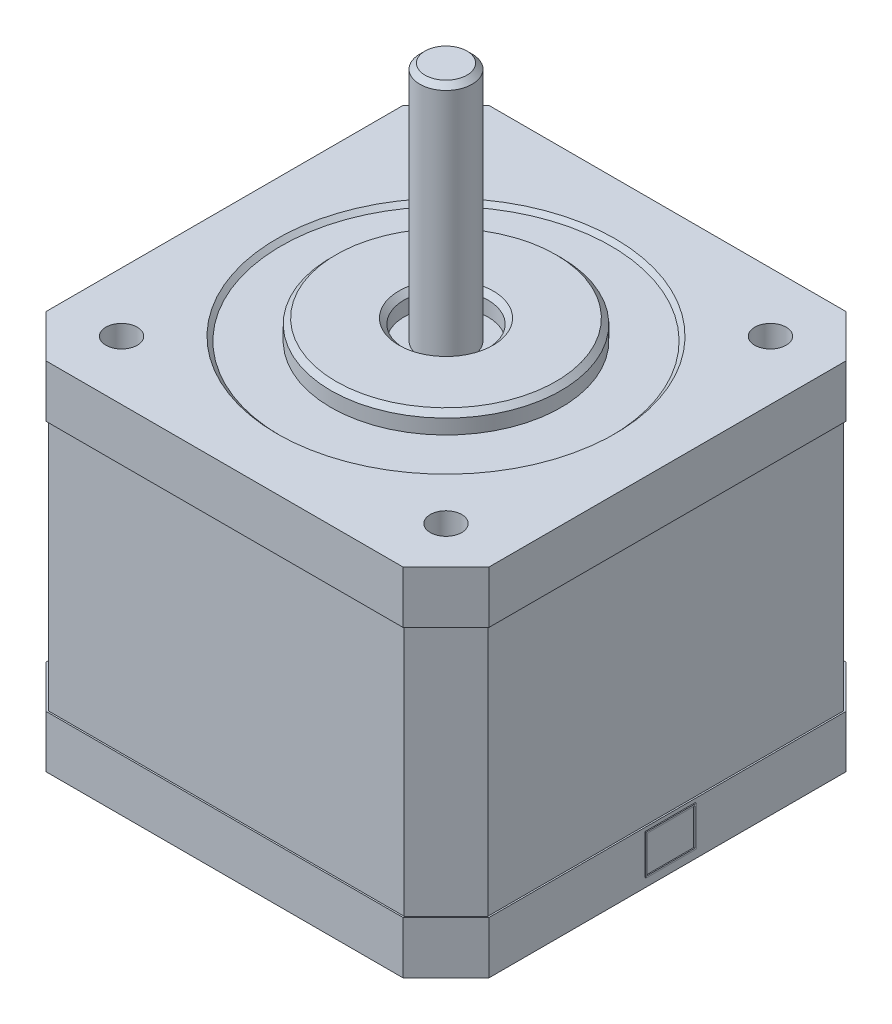
from build123d import *

# Parameters (mm, degrees)
SKETCH1_W           = 42
SKETCH1_H           = 42
BOSS_EXTRUDE1_DEPTH = 34
CHAMFER1_SIZE       = 4
BOSS_EXTRUDE4_DEPTH = 5
BOSS_EXTRUDE5_DEPTH = 5
SKETCH2_R           = 16.25
CUT_EXTRUDE1_DEPTH  = 0.4
SKETCH3_R           = 11
SKETCH3_R_2         = 4
BOSS_EXTRUDE2_DEPTH = 1.9
SKETCH4_R           = 2.5
BOSS_EXTRUDE3_DEPTH = 23
CHAMFER2_SIZE       = 0.5
SKETCH5_R           = 1.5
CUT_EXTRUDE2_DEPTH  = 5
SKETCH8_W           = 4.8
SKETCH8_H           = 3.8
SKETCH8_W_2         = 4.5
SKETCH8_H_2         = 3.5
BOSS_EXTRUDE6_DEPTH = 0.1


with BuildPart() as part:
    # Sketch1 → Boss-Extrude1 (new body)
    with BuildSketch(Plane(origin=(0, 0, 0), x_dir=(1, 0, 0), z_dir=(0, 1, 0))):
        Rectangle(SKETCH1_W, SKETCH1_H)
    extrude(amount=BOSS_EXTRUDE1_DEPTH)

    # Chamfer1
    chamfer1_edges = [part.edges().sort_by_distance(p)[0] for p in [
        (21, 17, 21),
        (-21, 17, 21),
        (-21, 17, -21),
        (21, 17, -21),
    ]]
    chamfer(chamfer1_edges, length=CHAMFER1_SIZE)

    # Sketch6 → Boss-Extrude4 (add)
    with BuildSketch(Plane(origin=(0, 34, 0), x_dir=(1, 0, 0), z_dir=(0, 1, 0))):
        Polygon((17.062132034, 21.15), (-17.062132034, 21.15), (-21.15, 17.062132034), (-21.15, -17.062132034), (-17.062132034, -21.15), (17.062132034, -21.15), (21.15, -17.062132034), (21.15, 17.062132034), align=None)
    extrude(amount=-BOSS_EXTRUDE4_DEPTH)

    # Sketch7 → Boss-Extrude5 (add)
    with BuildSketch(Plane.XZ):
        Polygon((-21.15, 17.062132034), (-21.15, -17.062132034), (-17.062132034, -21.15), (17.062132034, -21.15), (21.15, -17.062132034), (21.15, 17.062132034), (17.062132034, 21.15), (-17.062132034, 21.15), align=None)
    extrude(amount=-BOSS_EXTRUDE5_DEPTH)

    # Sketch2 → Cut-Extrude1 (cut)
    with BuildSketch(Plane(origin=(0, 34, 0), x_dir=(1, 0, 0), z_dir=(0, 1, 0))):
        with Locations(Location((0, 0, 0), (0, 0, 270))):
            Circle(SKETCH2_R)
    extrude(amount=-CUT_EXTRUDE1_DEPTH, mode=Mode.SUBTRACT)

    # Sketch3 → Boss-Extrude2 (add)
    with BuildSketch(Plane(origin=(0, 33.6, 0), x_dir=(1, 0, 0), z_dir=(0, 1, 0))):
        with Locations(Location((0, 0, 0), (0, 0, 90))):
            Circle(SKETCH3_R)
        with Locations(Location((0, 0, 0), (0, 0, 90))):
            Circle(SKETCH3_R_2, mode=Mode.SUBTRACT)
    extrude(amount=BOSS_EXTRUDE2_DEPTH)

    # Sketch4 → Boss-Extrude3 (add)
    with BuildSketch(Plane(origin=(0, 33.6, 0), x_dir=(1, 0, 0), z_dir=(0, 1, 0))):
        with Locations(Location((0, 0, 0), (0, 0, 270))):
            Circle(SKETCH4_R)
    extrude(amount=BOSS_EXTRUDE3_DEPTH)

    # Chamfer2
    # the kernel refuses this chamfer: 0.5 mm, written as the material it adds along each edge
    with BuildSketch(Plane(origin=(0, 33.6, 0), x_dir=(0, 0, 1), z_dir=(-1, 0, 0))) as chamfer2_piece_1_section:
        Polygon((16.25, CHAMFER2_SIZE), (16.25 - CHAMFER2_SIZE, 0), (16.25, 0), align=None)
    chamfer2_piece_1 = revolve(axis=Axis((0, 33.6, 0), (0, 1, 0)), mode=Mode.PRIVATE)
    chamfer2_piece_1 = split(chamfer2_piece_1, bisect_by=Plane(origin=(0, 34, -15.959627936), z_dir=(0, -1, 0)), keep=Keep.TOP, mode=Mode.PRIVATE)
    add(chamfer2_piece_1)
    # the kernel refuses this chamfer: 0.5 mm, written as the material it takes off along each edge
    with BuildSketch(Plane(origin=(0, 35.5, 0), x_dir=(0, 0, -1), z_dir=(1, 0, 0))) as chamfer2_2_piece_1:
        Polygon((4 + CHAMFER2_SIZE, 0), (4, -CHAMFER2_SIZE), (4, 0), align=None)
    revolve(axis=Axis((0, 35.5, 0), (0, 1, 0)), mode=Mode.SUBTRACT)
    with BuildSketch(Plane(origin=(0, 35.5, 0), x_dir=(0, 0, -1), z_dir=(1, 0, 0))) as chamfer2_2_piece_2:
        Polygon((11, -CHAMFER2_SIZE), (11 - CHAMFER2_SIZE, 0), (11, 0), align=None)
    revolve(axis=Axis((0, 35.5, 0), (0, 1, 0)), mode=Mode.SUBTRACT)
    with BuildSketch(Plane(origin=(0, 56.6, 0), x_dir=(0, 0, 1), z_dir=(-1, 0, 0))) as chamfer2_2_piece_3:
        Polygon((2.5, -CHAMFER2_SIZE), (2.5 - CHAMFER2_SIZE, 0), (2.5, 0), align=None)
    revolve(axis=Axis((0, 56.6, 0), (0, 1, 0)), mode=Mode.SUBTRACT)

    # Sketch5 → Cut-Extrude2 (cut)
    with BuildSketch(Plane(origin=(0, 34, 0), x_dir=(1, 0, 0), z_dir=(0, 1, 0))):
        with Locations(Location((-15.5, 15.5, 0), (0, 0, 270))):
            Circle(SKETCH5_R)
        with Locations(Location((15.5, 15.5, 0), (0, 0, 270))):
            Circle(SKETCH5_R)
        with Locations(Location((15.5, -15.5, 0), (0, 0, 270))):
            Circle(SKETCH5_R)
        with Locations(Location((-15.5, -15.5, 0), (0, 0, 270))):
            Circle(SKETCH5_R)
    extrude(amount=-CUT_EXTRUDE2_DEPTH, mode=Mode.SUBTRACT)

    # Sketch8 → Boss-Extrude6 (add)
    with BuildSketch(Plane(origin=(21.15, 0, 0), x_dir=(0, 0, -1), z_dir=(1, 0, 0))):
        with Locations((0.269797982, 2.75)):
            Rectangle(SKETCH8_W, SKETCH8_H)
        with Locations((0.269797982, 2.75)):
            Rectangle(SKETCH8_W_2, SKETCH8_H_2, mode=Mode.SUBTRACT)
    extrude(amount=BOSS_EXTRUDE6_DEPTH)


solid = part.part
